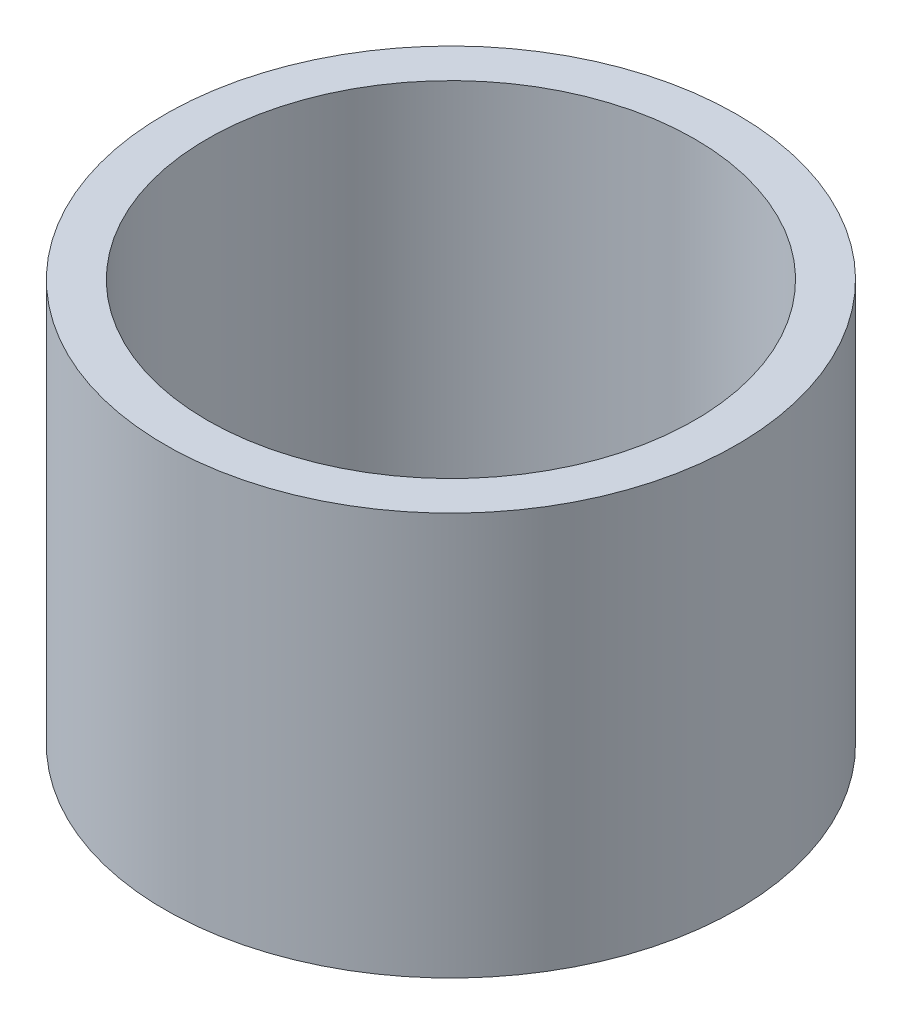
from build123d import *

# Parameters (mm, degrees)
SKETCH1_R           = 1.35
BOSS_EXTRUDE1_DEPTH = 1.9
SKETCH2_R           = 1.15
CUT_EXTRUDE1_DEPTH  = 3.69351072


with BuildPart() as part:
    # Sketch1 → Boss-Extrude1 (new body)
    with BuildSketch(Plane(origin=(0, 0, 0), x_dir=(1, 0, 0), z_dir=(0, 1, 0))):
        Circle(SKETCH1_R)
    extrude(amount=BOSS_EXTRUDE1_DEPTH)

    # Sketch2 → Cut-Extrude1 (cut, through all)
    with BuildSketch(Plane(origin=(0, 1.9, 0), x_dir=(1, 0, 0), z_dir=(0, 1, 0))):
        Circle(SKETCH2_R)
    extrude(amount=-CUT_EXTRUDE1_DEPTH, mode=Mode.SUBTRACT)


solid = part.part
